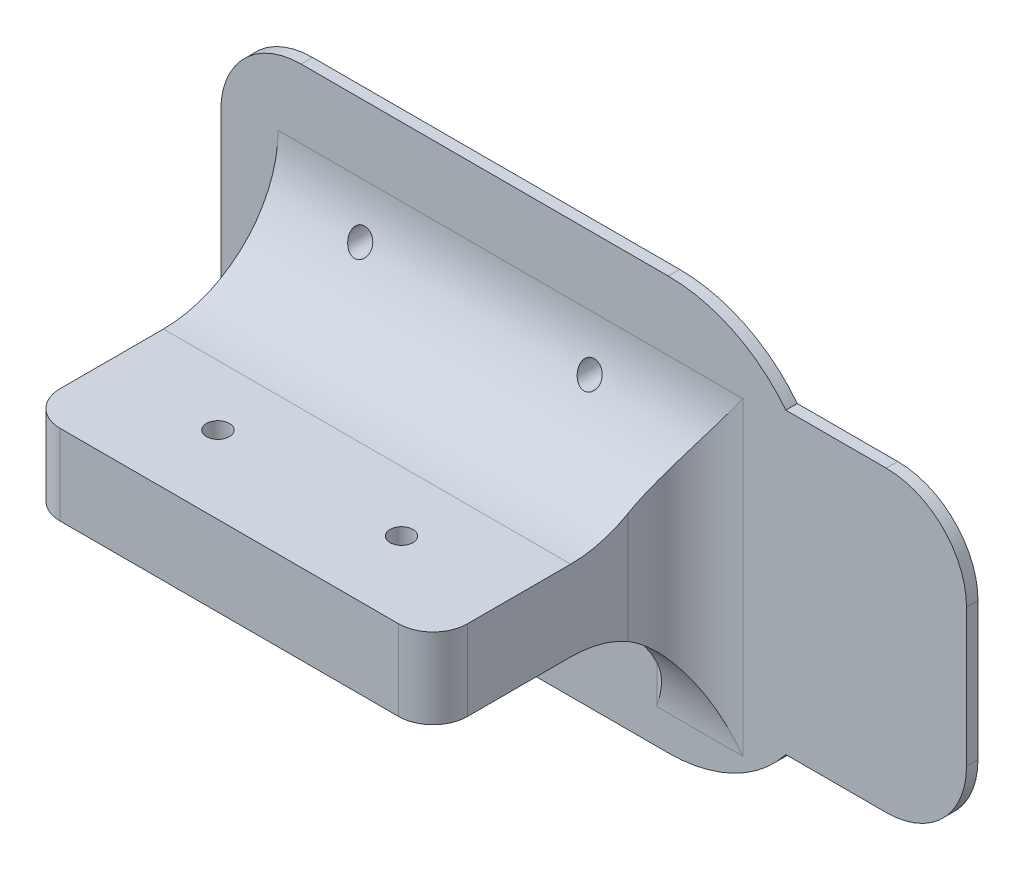
from build123d import *

# Parameters (mm, degrees)
INSERT_IN_SHEET_METAL_HOLE_DEPTH  = 1
BOSS_EXTRUDE5_DEPTH               = 1
SKETCH2_W                         = 24
SKETCH2_H                         = 2
LED_BACKING_DEPTH                 = 55
SKETCH3_R                         = 1
LED_SCREWHOLES_DEPTH              = 10
LED_BACKING_CLEANUP_DEPTH         = 52.613951602
LED_BACKING_CLEANUP_DEPTH_BACK    = 52.613951602
SKETCH5_W                         = 19.5
SKETCH5_H                         = 22
FILLET1_R                         = 3
BOSS_EXTRUDE3_START               = 5
BOSS_EXTRUDE3_DEPTH               = 5
FILLET2_R                         = 10
FILLET3_R                         = 5
FILLET4_R                         = 1
SKETCH7_R                         = 2.5
LED_WIRE_HOLES_DEPTH              = 51.714889332
SCREWHOLES_FOR_BACKING_DEPTH      = 51.714889332
SCREWHOLES_FOR_BACKING_DEPTH_BACK = 51.714889332
SKETCH8_R                         = 1
SKETCH9_W                         = 10
SKETCH9_H                         = 2
BOSS_EXTRUDE4_DEPTH               = 1
FILLET5_R                         = 3


with BuildPart() as part:
    # Sketch1 → Insert in sheet metal hole (new body)
    with BuildSketch(Plane.XY):
        with BuildLine():
            Line((-18, 11), (-18, -11))
            ThreePointArc((-18, -11), (-17.414213562, -12.414213562), (-16, -13))
            Line((-16, -13), (16, -13))
            ThreePointArc((16, -13), (20, -11.92820323), (22.92820323, -9))
            ThreePointArc((22.92820323, -9), (23.660254038, -8.267949192), (24.660254038, -8))
            Line((24.660254038, -8), (35, -8))
            ThreePointArc((35, -8), (36.414213562, -7.414213562), (37, -6))
            Line((37, -6), (37, 6))
            ThreePointArc((37, 6), (36.414213562, 7.414213562), (35, 8))
            Line((35, 8), (24.660254038, 8))
            ThreePointArc((24.660254038, 8), (23.660254038, 8.267949192), (22.92820323, 9))
            ThreePointArc((22.92820323, 9), (20, 11.92820323), (16, 13))
            Line((16, 13), (-16, 13))
            ThreePointArc((-16, 13), (-17.414213562, 12.414213562), (-18, 11))
        make_face()
    extrude(amount=INSERT_IN_SHEET_METAL_HOLE_DEPTH)

    # Sketch10 → Boss-Extrude5 (add)
    with BuildSketch(Plane.XY.offset(1)):
        with BuildLine():
            Line((26.246950766, -13), (35, -13))
            ThreePointArc((35, -13), (39.949747468, -10.949747468), (42, -6))
            Line((42, -6), (42, 6))
            ThreePointArc((42, 6), (39.949747468, 10.949747468), (35, 13))
            Line((35, 13), (26.246950766, 13))
            ThreePointArc((26.246950766, 13), (21.700877125, 16.683321446), (16, 18))
            Line((16, 18), (-16, 18))
            ThreePointArc((-16, 18), (-20.949747468, 15.949747468), (-23, 11))
            Line((-23, 11), (-23, -11))
            ThreePointArc((-23, -11), (-20.949747468, -15.949747468), (-16, -18))
            Line((-16, -18), (16, -18))
            ThreePointArc((16, -18), (21.700877125, -16.683321446), (26.246950766, -13))
        make_face()
    extrude(amount=BOSS_EXTRUDE5_DEPTH)

    # Sketch2 → LED backing (add)
    with BuildSketch(Plane.ZY.offset(18)):
        with Locations((12, 1)):
            Rectangle(SKETCH2_W, SKETCH2_H)
    extrude(amount=-LED_BACKING_DEPTH)

    # Sketch3 → LED screwholes (cut)
    with BuildSketch(Plane.XZ):
        with Locations(Location((-8, 17.25, 0), (0, 0, 270))):
            Circle(SKETCH3_R)
        with Locations(Location((8, 17.25, 0), (0, 0, 270))):
            Circle(SKETCH3_R)
    extrude(amount=-LED_SCREWHOLES_DEPTH, mode=Mode.SUBTRACT)

    # Sketch5 → LED backing cleanup (cut, two sides: drawn at the far end of the back side and taken through both)
    with BuildSketch(Plane.XZ.offset(-LED_BACKING_CLEANUP_DEPTH_BACK)):
        with Locations((27.25, 13)):
            Rectangle(SKETCH5_W, SKETCH5_H)
    extrude(amount=LED_BACKING_CLEANUP_DEPTH + LED_BACKING_CLEANUP_DEPTH_BACK, mode=Mode.SUBTRACT)

    # Fillet1
    fillet1_edges = [part.edges().sort_by_distance(p)[0] for p in [
        (17.5, 1, 24),
        (-18, 1, 24),
    ]]
    fillet(fillet1_edges, radius=FILLET1_R)

    # Sketch6 → Boss-Extrude3 (add)
    with BuildSketch(Plane.XZ.offset(BOSS_EXTRUDE3_START)):
        with BuildLine():
            Line((14.5, 24), (-15, 24))
            ThreePointArc((-15, 24), (-17.121320344, 23.121320344), (-18, 21))
            Line((-18, 21), (-18, 2))
            Line((-18, 2), (-16.5, 2))
            Line((-16.5, 2), (-16.5, 3.5))
            Line((-16.5, 3.5), (-16.5, 21))
            ThreePointArc((-16.5, 21), (-16.060660172, 22.060660172), (-15, 22.5))
            Line((-15, 22.5), (14.5, 22.5))
            ThreePointArc((14.5, 22.5), (15.560660172, 22.060660172), (16, 21))
            Line((16, 21), (16, 3.5))
            Line((16, 3.5), (16, 2))
            Line((16, 2), (17.5, 2))
            Line((17.5, 2), (17.5, 21))
            ThreePointArc((17.5, 21), (16.621320344, 23.121320344), (14.5, 24))
        make_face()
    extrude(amount=-BOSS_EXTRUDE3_DEPTH)

    # Fillet2
    fillet2_edges = [part.edges().sort_by_distance(p)[0] for p in [
        (-0.25, 2, 2),
        (-17.25, -5, 2),
        (16.75, -5, 2),
    ]]
    fillet(fillet2_edges, radius=FILLET2_R)

    # Fillet3
    fillet3_edges = [part.edges().sort_by_distance(p)[0] for p in [
        (17.5, -1.5, 2),
    ]]
    fillet(fillet3_edges, radius=FILLET3_R)

    # Fillet4
    fillet4_edges = [part.edges().sort_by_distance(p)[0] for p in [
        (-0.25, 0, 2),
        (-16.5, 0, 11.5),
        (-16.5, -7.5, 2),
        (-16.060660172, 0, 22.060660172),
        (-0.25, 0, 22.5),
        (15.560660172, 0, 22.060660172),
        (16, 0, 11.5),
        (16, -7.5, 2),
    ]]
    fillet(fillet4_edges, radius=FILLET4_R)

    # Sketch7 → LED wire holes (cut, through all)
    with BuildSketch(Plane.XY.offset(2)):
        with Locations((-13, -3.5)):
            Circle(SKETCH7_R)
        with Locations((12.5, -3.5)):
            Circle(SKETCH7_R)
    extrude(amount=-LED_WIRE_HOLES_DEPTH, mode=Mode.SUBTRACT)

    # Sketch8 → Screwholes for backing (cut, two sides: drawn at the far end of the back side and taken through both)
    with BuildSketch(Plane.XY.offset(2).offset(-SCREWHOLES_FOR_BACKING_DEPTH_BACK)):
        with Locations((0, -8)):
            Circle(SKETCH8_R)
        with Locations((-10, 8)):
            Circle(SKETCH8_R)
        with Locations((10, 8)):
            Circle(SKETCH8_R)
    extrude(amount=SCREWHOLES_FOR_BACKING_DEPTH + SCREWHOLES_FOR_BACKING_DEPTH_BACK, mode=Mode.SUBTRACT)

    # Sketch9 → Boss-Extrude4 (add)
    with BuildSketch(Plane.XY.offset(2)):
        with Locations((0, -2.75)):
            Rectangle(SKETCH9_W, SKETCH9_H)
    extrude(amount=BOSS_EXTRUDE4_DEPTH)

    # Fillet5
    # the kernel refuses this fillet: 3 mm, written as the material it adds along each edge
    with BuildSketch(Plane(origin=(5, -1.75, 2), x_dir=(1, 0, 0), z_dir=(0, -1, 0)), Plane(origin=(-5, -3.75, 2), x_dir=(-1, 0, 0), z_dir=(0, 1, 0))) as fillet5_piece_1:
        with BuildLine():
            CenterArc((2.236067977, 3), FILLET5_R, 221.810314896, 48.189685104)
            Line((0, 1), (0, 0))
            Line((0, 0), (2.236067977, 0))
        make_face()
    extrude(amount=2)
    with BuildSketch(Plane(origin=(5, -3.75, 2), x_dir=(0, -1, 0), z_dir=(-1, 0, 0))) as fillet5_piece_2:
        with BuildLine():
            CenterArc((2.236067977, 3), FILLET5_R, 221.810314896, 48.189685104)
            Line((0, 1), (0, 0))
            Line((0, 0), (2.236067977, 0))
        make_face()
    extrude(amount=10)
    with BuildSketch(Plane(origin=(10.590169944, -3.75, 2), x_dir=(0, -1, 0), z_dir=(-1, 0, 0))) as fillet5_piece_3a_section:
        with BuildLine():
            CenterArc((2.236067977, 3), FILLET5_R, 221.810314896, 48.189685104)
            Line((0, 1), (0, 0))
            Line((0, 0), (2.236067977, 0))
        make_face()
    fillet5_piece_3a = extrude(amount=15.590169944, mode=Mode.PRIVATE)
    fillet5_piece_3a = fillet5_piece_3a - Plane(origin=(12.5, -3.5, 2), x_dir=(1, 0, 0), z_dir=(0, 0, 1)) * Cylinder(2.5, 41, mode=Mode.PRIVATE)
    fillet5_piece_3a = split(fillet5_piece_3a, bisect_by=Plane(origin=(5, -3.75, 2), z_dir=(1, 0, 0)), keep=Keep.TOP, mode=Mode.PRIVATE)
    with BuildSketch(Plane(origin=(5, -1.75, 2), x_dir=(1, 0, 0), z_dir=(0, -1, 0))) as fillet5_piece_3b_section:
        with BuildLine():
            CenterArc((2.236067977, 3), FILLET5_R, 221.810314896, 48.189685104)
            Line((0, 1), (0, 0))
            Line((0, 0), (2.236067977, 0))
        make_face()
    fillet5_piece_3b = extrude(amount=7.590169944, mode=Mode.PRIVATE)
    fillet5_piece_3b = split(fillet5_piece_3b, bisect_by=Plane(origin=(5, -3.75, 2), z_dir=(0, -1, 0)), keep=Keep.TOP, mode=Mode.PRIVATE)
    fillet5_piece_3 = fillet5_piece_3a & fillet5_piece_3b
    add(fillet5_piece_3)
    with BuildSketch(Plane(origin=(-5, -9.340169944, 2), x_dir=(-1, 0, 0), z_dir=(0, 1, 0))) as fillet5_piece_4a_section:
        with BuildLine():
            CenterArc((2.236067977, 3), FILLET5_R, 221.810314896, 48.189685104)
            Line((0, 1), (0, 0))
            Line((0, 0), (2.236067977, 0))
        make_face()
    fillet5_piece_4a = extrude(amount=7.590169944, mode=Mode.PRIVATE)
    fillet5_piece_4a = split(fillet5_piece_4a, bisect_by=Plane(origin=(-5, -3.75, 2), z_dir=(0, -1, 0)), keep=Keep.TOP, mode=Mode.PRIVATE)
    with BuildSketch(Plane(origin=(5, -3.75, 2), x_dir=(0, -1, 0), z_dir=(-1, 0, 0))) as fillet5_piece_4b_section:
        with BuildLine():
            CenterArc((2.236067977, 3), FILLET5_R, 221.810314896, 48.189685104)
            Line((0, 1), (0, 0))
            Line((0, 0), (2.236067977, 0))
        make_face()
    fillet5_piece_4b = extrude(amount=15.590169944, mode=Mode.PRIVATE)
    fillet5_piece_4b = split(fillet5_piece_4b, bisect_by=Plane(origin=(-5, -3.75, 2), z_dir=(-1, 0, 0)), keep=Keep.TOP, mode=Mode.PRIVATE)
    fillet5_piece_4b = fillet5_piece_4b - Plane(origin=(-13, -3.5, 2), x_dir=(1, 0, 0), z_dir=(0, 0, 1)) * Cylinder(2.5, 41, mode=Mode.PRIVATE)
    fillet5_piece_4 = fillet5_piece_4a & fillet5_piece_4b
    add(fillet5_piece_4)


solid = part.part
